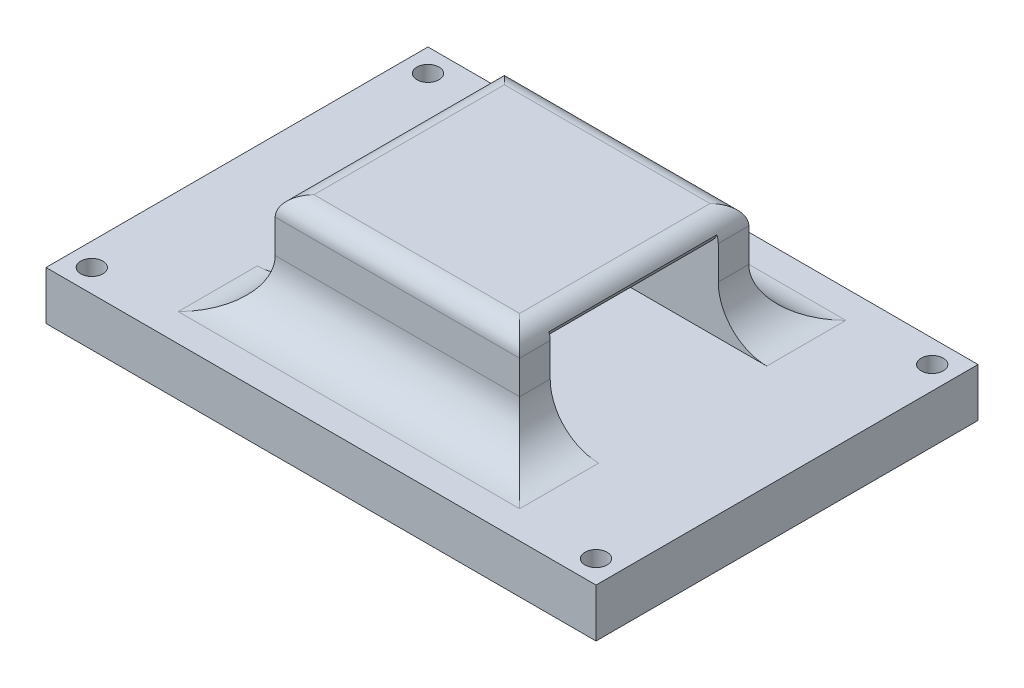
from build123d import *

# Parameters (mm, degrees)
SKETCH2_W            = 30
SKETCH2_H            = 19.6
SKETCH2_W_2          = 22
SKETCH2_H_2          = 10
BOSS_EXTRUDE2_DEPTH  = 32
SKETCH3_W            = 72
SKETCH3_H            = 50
BOSS_EXTRUDE3_DEPTH  = 6.35
SKETCH4_R            = 1.45
CUT_EXTRUDE1_DEPTH   = 6.35
LPATTERN1_COUNT      = 2
LPATTERN1_PITCH      = 66.000000014
LPATTERN1_COUNT_DIR2 = 2
LPATTERN1_PITCH_DIR2 = 44.000000072
FILLET1_R            = 6.35
FILLET2_R            = 2.54
FILLET3_R            = 2.54


with BuildPart() as part:
    # Sketch2 → Boss-Extrude2 (new body)
    with BuildSketch(Plane(origin=(0, 0, 0), x_dir=(0, 0, -1), z_dir=(1, 0, 0))):
        with Locations((0, -1.55)):
            Rectangle(SKETCH2_W, SKETCH2_H)
        Rectangle(SKETCH2_W_2, SKETCH2_H_2, mode=Mode.SUBTRACT)
    extrude(amount=BOSS_EXTRUDE2_DEPTH)

    # Sketch3 → Boss-Extrude3 (add)
    with BuildSketch(Plane.XZ.offset(11.35)):
        with Locations((16, 0)):
            Rectangle(SKETCH3_W, SKETCH3_H)
    extrude(amount=-BOSS_EXTRUDE3_DEPTH)

    # Sketch4 → Cut-Extrude1 (cut)
    with BuildSketch(Plane(origin=(0, -5, 0), x_dir=(1, 0, 0), z_dir=(0, 1, 0))):
        with Locations(Location((-17, -22.000006, 0), (0, 0, 270))):
            Circle(SKETCH4_R)
    cut_extrude1 = extrude(amount=-CUT_EXTRUDE1_DEPTH, mode=Mode.SUBTRACT)

    # LPattern1: Cut-Extrude1 2 × 2
    with Locations(*[(i * LPATTERN1_PITCH, 0, -j * LPATTERN1_PITCH_DIR2) for i in range(LPATTERN1_COUNT) for j in range(LPATTERN1_COUNT_DIR2) if (i, j) != (0, 0)]):
        add(cut_extrude1, mode=Mode.SUBTRACT)

    # Fillet1
    fillet1_edges = [part.edges().sort_by_distance(p)[0] for p in [
        (0, -5, 13),
        (0, -5, -13),
        (16, -5, 15),
        (32, -5, 13),
        (32, -5, -13),
        (16, -5, -15),
    ]]
    fillet(fillet1_edges, radius=FILLET1_R)

    # Fillet2
    fillet2_edges = [part.edges().sort_by_distance(p)[0] for p in [
        (0, 8.25, 0),
        (16, 8.25, 15),
        (16, 8.25, -15),
        (32, 8.25, 0),
    ]]
    fillet(fillet2_edges, radius=FILLET2_R)

    # Fillet3
    # the kernel refuses this fillet: 2.54 mm, written as the material it takes off along each edge
    with BuildSketch(Plane(origin=(0, 5, -11), x_dir=(0, 1, 0), z_dir=(0, 0, 1))) as fillet3_piece_1:
        with BuildLine():
            CenterArc((FILLET3_R, -FILLET3_R), FILLET3_R, 90, 90)
            Line((0, -FILLET3_R), (0, 0))
            Line((0, 0), (FILLET3_R, 0))
        make_face()
    extrude(amount=22, mode=Mode.SUBTRACT)
    with BuildSketch(Plane(origin=(32, 5, -11), x_dir=(0, 1, 0), z_dir=(0, 0, 1))) as fillet3_piece_2:
        with BuildLine():
            CenterArc((FILLET3_R, FILLET3_R), FILLET3_R, 180, 90)
            Line((0, FILLET3_R), (0, 0))
            Line((0, 0), (FILLET3_R, 0))
        make_face()
    extrude(amount=22, mode=Mode.SUBTRACT)


solid = part.part
